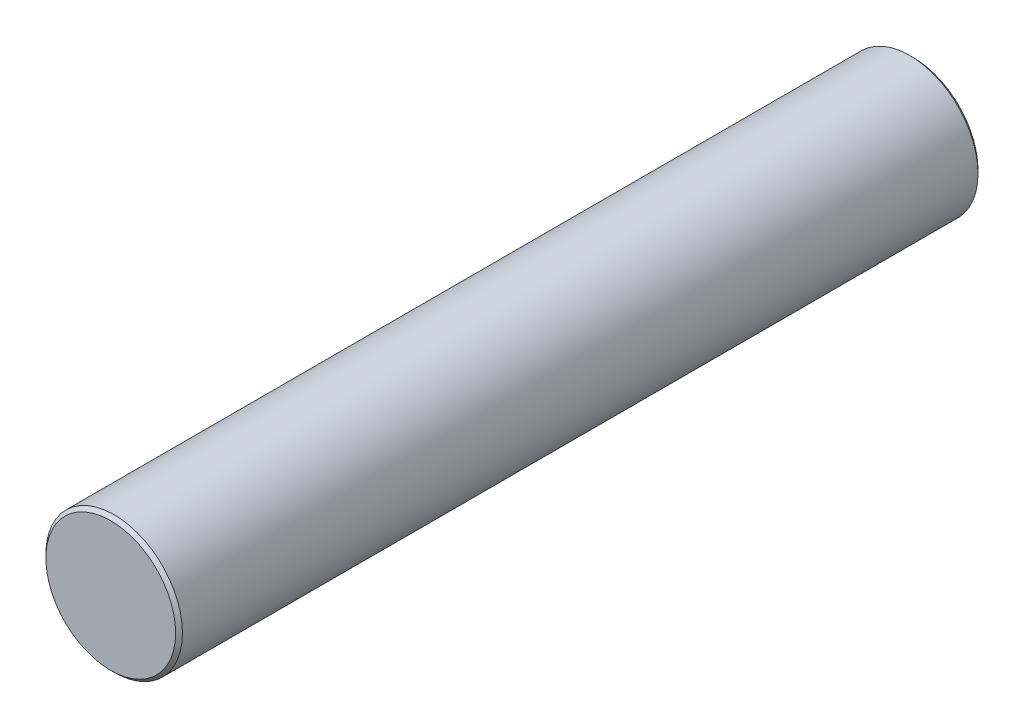
from build123d import *

# Parameters (mm, degrees)
SKETCH2_R           = 1
BOSS_EXTRUDE1_DEPTH = 11.75
CHAMFER2_SIZE       = 0.05


with BuildPart() as part:
    # Sketch2 → Boss-Extrude1 (new body)
    with BuildSketch(Plane.XY):
        Circle(SKETCH2_R)
    extrude(amount=BOSS_EXTRUDE1_DEPTH)

    # Chamfer2
    chamfer2_edges = [part.edges().sort_by_distance(p)[0] for p in [
        (-1, 0, 11.75),
        (-1, 0, 0),
    ]]
    chamfer(chamfer2_edges, length=CHAMFER2_SIZE)


solid = part.part
